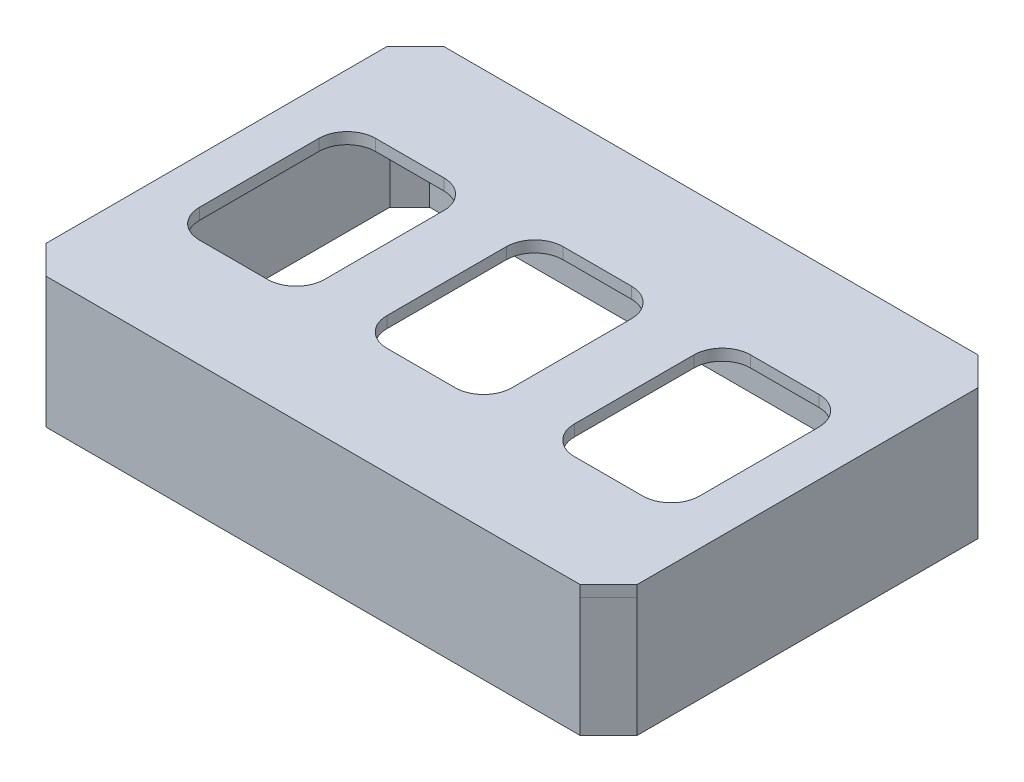
from build123d import *

# Parameters (mm, degrees)
SKETCH1_W           = 104
SKETCH1_H           = 70
SKETCH1_W_2         = 100.5
SKETCH1_H_2         = 64.5
BOSS_EXTRUDE1_DEPTH = 21
CHAMFER2_SIZE       = 3.5
CHAMFER3_SIZE       = 5
SKETCH3_W           = 104
SKETCH3_H           = 70
BOSS_EXTRUDE2_DEPTH = 2
CHAMFER4_SIZE       = 5
SKETCH4_W           = 22
SKETCH4_H           = 31
CUT_EXTRUDE1_DEPTH  = 2
FILLET1_R           = 5


with BuildPart() as part:
    # Sketch1 → Boss-Extrude1 (new body)
    with BuildSketch(Plane(origin=(0, 0, 0), x_dir=(1, 0, 0), z_dir=(0, 1, 0))):
        Rectangle(SKETCH1_W, SKETCH1_H)
        Rectangle(SKETCH1_W_2, SKETCH1_H_2, mode=Mode.SUBTRACT)
    extrude(amount=BOSS_EXTRUDE1_DEPTH)

    # Chamfer2
    chamfer2_edges = [part.edges().sort_by_distance(p)[0] for p in [
        (50.25, 10.5, 32.25),
        (50.25, 10.5, -32.25),
        (-50.25, 10.5, -32.25),
        (-50.25, 10.5, 32.25),
    ]]
    chamfer(chamfer2_edges, length=CHAMFER2_SIZE)

    # Chamfer3
    chamfer3_edges = [part.edges().sort_by_distance(p)[0] for p in [
        (52, 10.5, 35),
        (-52, 10.5, 35),
        (-52, 10.5, -35),
        (52, 10.5, -35),
    ]]
    chamfer(chamfer3_edges, length=CHAMFER3_SIZE)

    # Sketch3 → Boss-Extrude2 (add)
    with BuildSketch(Plane(origin=(0, 21, 0), x_dir=(1, 0, 0), z_dir=(0, 1, 0))):
        Rectangle(SKETCH3_W, SKETCH3_H)
    extrude(amount=BOSS_EXTRUDE2_DEPTH)

    # Chamfer4
    chamfer4_edges = [part.edges().sort_by_distance(p)[0] for p in [
        (-52, 22, 35),
        (52, 22, 35),
        (52, 22, -35),
        (-52, 22, -35),
    ]]
    chamfer(chamfer4_edges, length=CHAMFER4_SIZE - 0.0001)  # a hair under: the kernel refuses the full size

    # Sketch4 → Cut-Extrude1 (cut)
    with BuildSketch(Plane.XZ.offset(-21)):
        with Locations((0, 0.5)):
            Rectangle(SKETCH4_W, SKETCH4_H)
        with Locations((33, 0.5)):
            Rectangle(SKETCH4_W, SKETCH4_H)
        with Locations((-33, 0.5)):
            Rectangle(SKETCH4_W, SKETCH4_H)
    extrude(amount=-CUT_EXTRUDE1_DEPTH, mode=Mode.SUBTRACT)

    # Fillet1
    fillet1_edges = [part.edges().sort_by_distance(p)[0] for p in [
        (-11, 22, -15),
        (-11, 22, 16),
        (11, 22, 16),
        (11, 22, -15),
        (22, 22, -15),
        (22, 22, 16),
        (44, 22, 16),
        (44, 22, -15),
        (-22, 22, 16),
        (-22, 22, -15),
        (-44, 22, -15),
        (-44, 22, 16),
    ]]
    fillet(fillet1_edges, radius=FILLET1_R)


solid = part.part
